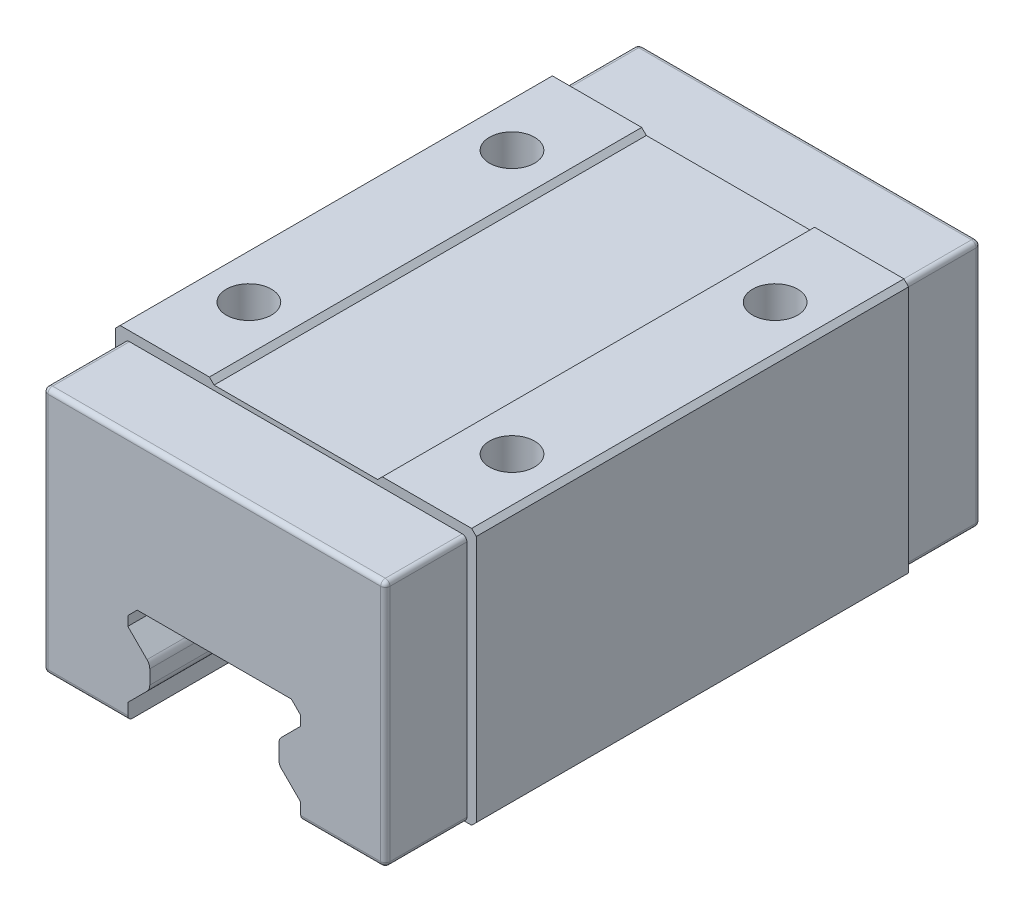
from build123d import *

# Parameters (mm, degrees)
SKETCH1_W           = 48
SKETCH1_H           = 34.2
BOSS_EXTRUDE1_DEPTH = 28.75
SKETCH2_W           = 45.5
SKETCH2_H           = 32.95
BOSS_EXTRUDE2_DEPTH = 39.6
SKETCH3_W           = 23
SKETCH3_H           = 19.2
CUT_EXTRUDE1_DEPTH  = 92.916483832
BOSS_EXTRUDE3_DEPTH = 79.2
CHAMFER1_SIZE       = 1.25
FILLET1_R           = 1.25
SKETCH5_W           = 23
SKETCH5_H           = 0.62
CUT_EXTRUDE2_DEPTH  = 83.750966762
CHAMFER2_SIZE       = 0.62
FILLET2_R           = 0.62
SKETCH6_R           = 3
CUT_EXTRUDE3_DEPTH  = 9


with BuildPart() as part:
    # Sketch1 → Boss-Extrude1 (new, symmetric)
    with BuildSketch(Plane.XY):
        with Locations((0, 22.9)):
            Rectangle(SKETCH1_W, SKETCH1_H)
    extrude(amount=BOSS_EXTRUDE1_DEPTH, both=True)

    # Sketch2 → Boss-Extrude2 (add, symmetric)
    with BuildSketch(Plane.XY):
        with Locations((0, 22.275)):
            Rectangle(SKETCH2_W, SKETCH2_H)
    extrude(amount=BOSS_EXTRUDE2_DEPTH, both=True)

    # Sketch3 → Cut-Extrude1 (cut, through all)
    with BuildSketch(Plane.XY.offset(39.6)):
        with Locations((0, 9.6)):
            Rectangle(SKETCH3_W, SKETCH3_H)
    extrude(amount=-CUT_EXTRUDE1_DEPTH, mode=Mode.SUBTRACT)

    # Sketch4 → Boss-Extrude3 (add)
    with BuildSketch(Plane.XY.offset(39.6)):
        Polygon((-11.5, 16.7), (-11.5, 7.95), (-8.583333333, 10.866666667), (-8.583333333, 13.783333333), align=None)
        Polygon((8.583333333, 13.783333333), (11.5, 16.7), (11.5, 7.95), (8.583333333, 10.866666667), align=None)
    extrude(amount=-BOSS_EXTRUDE3_DEPTH)

    # Chamfer1
    chamfer1_edges = [part.edges().sort_by_distance(p)[0] for p in [
        (11.5, 19.2, 0),
        (-11.5, 19.2, 0),
    ]]
    chamfer(chamfer1_edges, length=CHAMFER1_SIZE)

    # Fillet1
    fillet1_edges = [part.edges().sort_by_distance(p)[0] for p in [
        (-8.583333333, 10.866666667, 0),
        (-8.583333333, 13.783333333, 0),
        (8.583333333, 13.783333333, 0),
        (8.583333333, 10.866666667, 0),
    ]]
    fillet(fillet1_edges, radius=FILLET1_R)

    # Sketch5 → Cut-Extrude2 (cut, through all)
    with BuildSketch(Plane.XY.offset(28.75)):
        with Locations((0, 39.69)):
            Rectangle(SKETCH5_W, SKETCH5_H)
    extrude(amount=-CUT_EXTRUDE2_DEPTH, mode=Mode.SUBTRACT)

    # Chamfer2
    chamfer2_edges = [part.edges().sort_by_distance(p)[0] for p in [
        (-11.5, 39.38, 0),
        (11.5, 39.38, 0),
        (24, 5.8, 0),
        (-24, 5.8, 0),
        (-24, 40, 0),
        (24, 40, 0),
    ]]
    chamfer(chamfer2_edges, length=CHAMFER2_SIZE - 0.0001)  # a hair under: the kernel refuses the full size

    # Fillet2
    fillet2_edges = [part.edges().sort_by_distance(p)[0] for p in [
        (-22.75, 38.75, 34.175),
        (-22.75, 5.8, 34.175),
        (22.75, 5.8, 34.175),
        (22.75, 38.75, 34.175),
        (-22.75, 38.75, -34.175),
        (-22.75, 22.275, -39.6),
        (-22.75, 5.8, -34.175),
        (-17.125, 5.8, -39.6),
        (22.75, 5.8, -34.175),
        (22.75, 22.275, -39.6),
        (22.75, 38.75, -34.175),
        (0, 38.75, -39.6),
        (-22.75, 22.275, 39.6),
        (-17.125, 5.8, 39.6),
        (22.75, 22.275, 39.6),
        (0, 38.75, 39.6),
        (17.125, 5.8, 39.6),
        (17.125, 5.8, -39.6),
    ]]
    fillet(fillet2_edges, radius=FILLET2_R)

    # Sketch6 → Cut-Extrude3 (cut)
    with BuildSketch(Plane(origin=(0, 40, 0), x_dir=(1, 0, 0), z_dir=(0, 1, 0))):
        with Locations(Location((-17.5, -17.5, 0), (0, 0, 180))):
            Circle(SKETCH6_R)
        with Locations(Location((17.5, -17.5, 0), (0, 0, 180))):
            Circle(SKETCH6_R)
    cut_extrude3 = extrude(amount=-CUT_EXTRUDE3_DEPTH, mode=Mode.SUBTRACT)

    # Mirror1: Cut-Extrude3 across plane
    add(cut_extrude3.mirror(Plane.XY), mode=Mode.SUBTRACT)


solid = part.part
